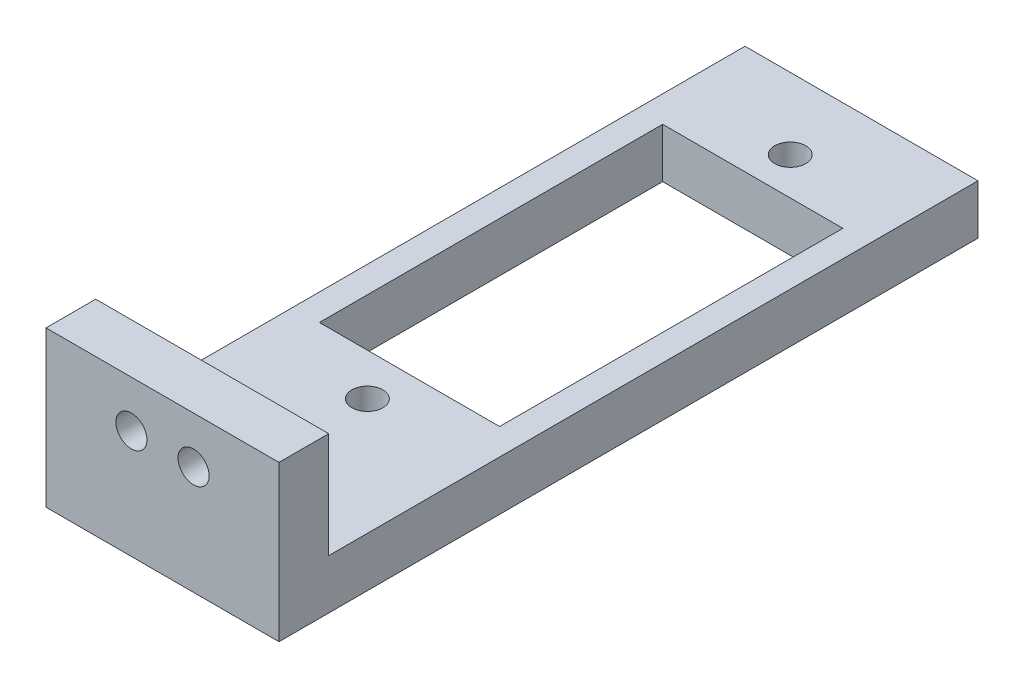
from build123d import *

# Parameters (mm, degrees)
SKETCH1_W           = 15
SKETCH1_H           = 45
BOSS_EXTRUDE1_DEPTH = 10
SKETCH4_W           = 15
SKETCH4_H           = 6.8
CUT_EXTRUDE2_DEPTH  = 41.8
SKETCH5_R           = 1
CUT_EXTRUDE3_DEPTH  = 47.703854231
SKETCH6_R           = 1
SKETCH6_W           = 11.6
SKETCH6_H           = 22.1
CUT_EXTRUDE4_DEPTH  = 25.67265693


with BuildPart() as part:
    # Sketch1 → Boss-Extrude1 (new body)
    with BuildSketch(Plane(origin=(0, 0, 0), x_dir=(1, 0, 0), z_dir=(0, 1, 0))):
        Rectangle(SKETCH1_W, SKETCH1_H)
    extrude(amount=BOSS_EXTRUDE1_DEPTH)

    # Sketch4 → Cut-Extrude2 (cut)
    with BuildSketch(Plane(origin=(0, 0, -22.5), x_dir=(-1, 0, 0), z_dir=(0, 0, -1))):
        with Locations((0, 6.6)):
            Rectangle(SKETCH4_W, SKETCH4_H)
    extrude(amount=-CUT_EXTRUDE2_DEPTH, mode=Mode.SUBTRACT)

    # Sketch5 → Cut-Extrude3 (cut, through all)
    with BuildSketch(Plane.XY.offset(22.5)):
        with Locations((-2, 7)):
            Circle(SKETCH5_R)
        with Locations((2, 7)):
            Circle(SKETCH5_R)
    extrude(amount=-CUT_EXTRUDE3_DEPTH, mode=Mode.SUBTRACT)

    # Sketch6 → Cut-Extrude4 (cut, through all)
    with BuildSketch(Plane(origin=(0, 3.2, 0), x_dir=(1, 0, 0), z_dir=(0, 1, 0))):
        with Locations((0, -9.31)):
            Circle(SKETCH6_R)
        with Locations((0, 17.91)):
            Circle(SKETCH6_R)
        with Locations((0, 4.45)):
            Rectangle(SKETCH6_W, SKETCH6_H)
    extrude(amount=-CUT_EXTRUDE4_DEPTH, mode=Mode.SUBTRACT)


solid = part.part
